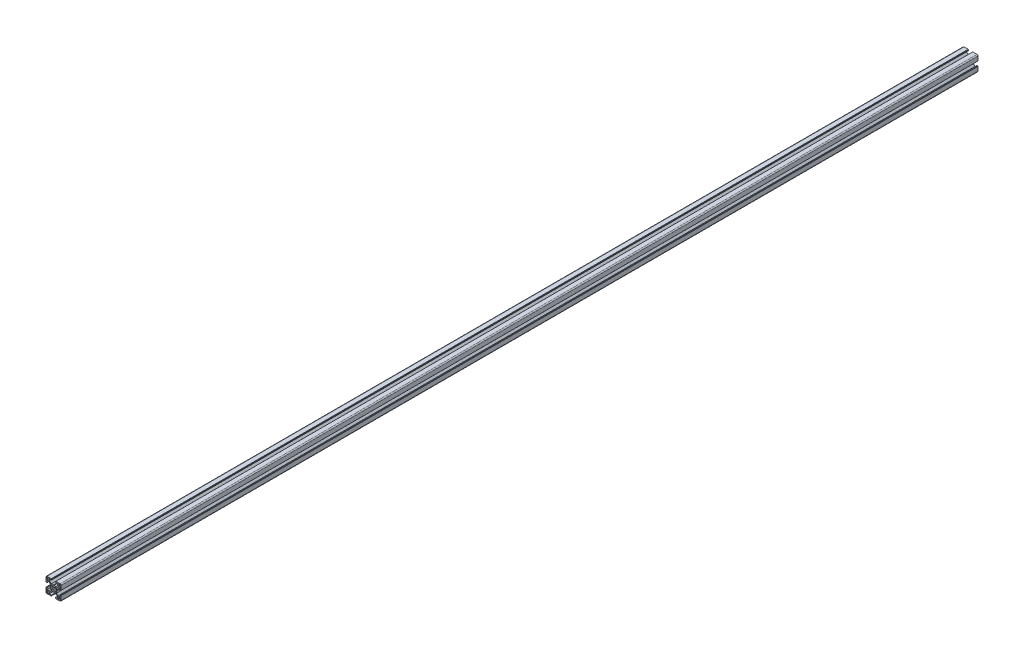
from build123d import *

# Parameters (mm, degrees)
BOSS_EXTRUDE1_DEPTH     = 1828.8
CUT_EXTRUDE1_DEPTH      = 1829.923027358
CUT_EXTRUDE1_DEPTH_BACK = 1829.923027358


with BuildPart() as part:
    # Sketch4 → Boss-Extrude1 (new body)
    with BuildSketch(Plane.XY):
        with BuildLine():
            Line((0, -5.45), (0.655464476, -6))
            Line((0.655464476, -6), (4.504469158, -6))
            Line((4.504469158, -6), (8.25, -9.745530842))
            Line((8.25, -9.745530842), (8.25, -12.885))
            Line((8.25, -12.885), (4, -12.885))
            Line((4, -12.885), (4, -14.45))
            Line((4, -14.45), (4.55, -14.45))
            Line((4.55, -14.45), (4.55, -15))
            Line((4.55, -15), (12.885, -15))
            ThreePointArc((12.885, -15), (14.380530842, -14.380530842), (15, -12.885))
            Line((15, -12.885), (15, -4.55))
            Line((15, -4.55), (14.45, -4.55))
            Line((14.45, -4.55), (14.45, -4))
            Line((14.45, -4), (12.885, -4))
            Line((12.885, -4), (12.885, -8.25))
            Line((12.885, -8.25), (9.745530842, -8.25))
            Line((9.745530842, -8.25), (6, -4.504469158))
            Line((6, -4.504469158), (6, -0.655464476))
            Line((6, -0.655464476), (5.45, 0))
            Line((5.45, 0), (3.5, 0))
            ThreePointArc((3.5, 0), (3.371433308, -0.939913534), (2.995178599, -1.81077474))
            Line((2.995178599, -1.81077474), (4.675743591, -3.491339732))
            Line((4.675743591, -3.491339732), (3.491339732, -4.675743591))
            Line((3.491339732, -4.675743591), (1.81077474, -2.995178599))
            ThreePointArc((1.81077474, -2.995178599), (0.939913534, -3.371433308), (0, -3.5))
            Line((0, -3.5), (0, -5.45))
        make_face()
        with BuildLine():
            Line((9.375, -10.365), (9.375, -12.885))
            ThreePointArc((9.375, -12.885), (9.664964287, -13.585035713), (10.365, -13.875))
            Line((10.365, -13.875), (12.885, -13.875))
            ThreePointArc((12.885, -13.875), (13.585035713, -13.585035713), (13.875, -12.885))
            Line((13.875, -12.885), (13.875, -10.365))
            ThreePointArc((13.875, -10.365), (13.585035713, -9.664964287), (12.885, -9.375))
            Line((12.885, -9.375), (10.365, -9.375))
            ThreePointArc((10.365, -9.375), (9.664964287, -9.664964287), (9.375, -10.365))
        make_face(mode=Mode.SUBTRACT)
    extrude(amount=BOSS_EXTRUDE1_DEPTH)

    # Mirror1: part across plane


with BuildPart() as part_1:
    add(part.part)
    add(part.part.mirror(Plane(origin=(0, 0, 0), x_dir=(0, 0, 1), z_dir=(1, 0, 0))))

    # Mirror2: part across plane


with BuildPart() as part_2:
    add(part_1.part)
    add(part_1.part.mirror(Plane.ZX))

    # Sketch5 → Cut-Extrude1 (cut, two sides: drawn at the far end of the back side and taken through both)
    with BuildSketch(Plane.XY.offset(1828.8).offset(-CUT_EXTRUDE1_DEPTH_BACK)):
        Polygon((-5.675, 12.885), (-5.4, 13.16), (-5.125, 12.885), align=None)
    extrude(amount=CUT_EXTRUDE1_DEPTH + CUT_EXTRUDE1_DEPTH_BACK, mode=Mode.SUBTRACT)


solid = part_2.part
